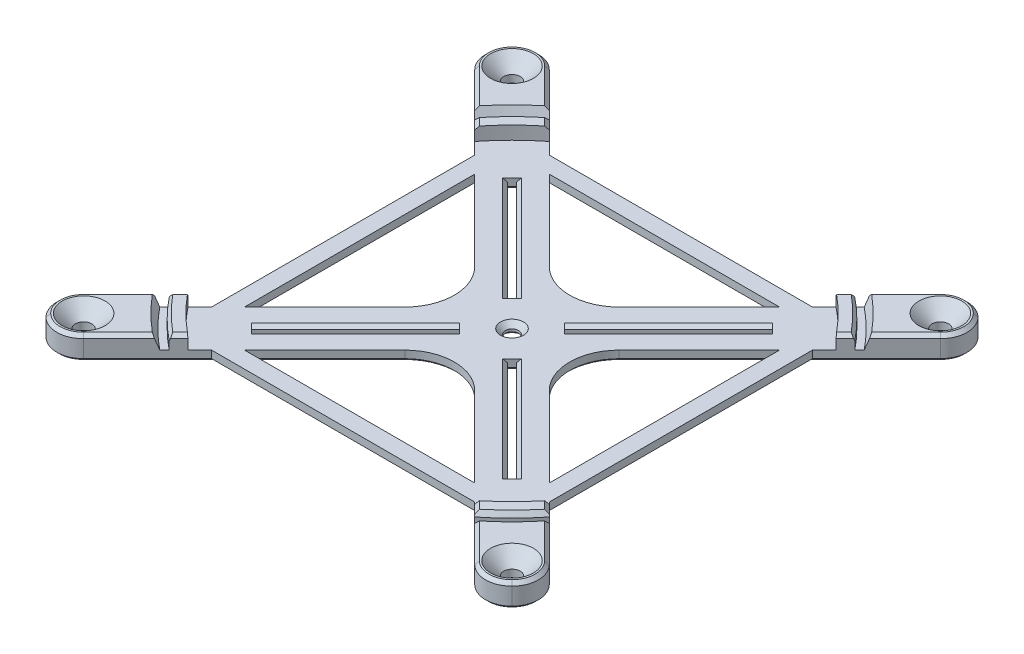
from build123d import *

# Parameters (mm, degrees)
EXTRUDE_1_DEPTH     = 14
EXTRUDE_2_DEPTH     = 14
FILLET_1_R          = 16
SKETCH_3_R          = 5
SKETCH_3_R_2        = 4
CUT_EXTRUDE_1_DEPTH = 208.101215987
FILLET_2_R          = 30
SKETCH_5_R          = 140
CUT_EXTRUDE_2_DEPTH = 8
CHAMFER_3_SIZE      = 8
CHAMFER_4_SIZE      = 2
CHAMFER_5_SIZE      = 3
CUT_EXTRUDE_4_DEPTH = 207.782285661
CHAMFER_6_SIZE      = 2
SKETCH_9_W          = 172.613296279
SKETCH_9_H          = 10
SKETCH_9_W_2        = 10
SKETCH_9_H_2        = 172.613296279
EXTRUDE_3_DEPTH     = 6
CHAMFER_7_SIZE      = 1.5
CHAMFER_8_SIZE      = 1.732050808
CHAMFER_8_SIZE_2    = 3


# Some blends are built 0.0001 mm under size
with BuildPart() as part:
    # Эскиз1 → Бобышка-Вытянуть1 (new body)
    with BuildSketch(Plane(origin=(0, 0, 0), x_dir=(1, 0, 0), z_dir=(0, 1, 0))):
        Polygon((130.107647738, -152.735064736), (-152.735064736, 130.107647738), (-130.107647738, 152.735064736), (152.735064736, -130.107647738), align=None)
    extrude(amount=EXTRUDE_1_DEPTH)

    # Эскиз2 → Бобышка-Вытянуть2 (add)
    with BuildSketch(Plane(origin=(0, 0, 0), x_dir=(1, 0, 0), z_dir=(0, 1, 0))):
        Polygon((-152.735064736, -130.107647738), (130.107647738, 152.735064736), (152.735064736, 130.107647738), (-130.107647738, -152.735064736), align=None)
    extrude(amount=EXTRUDE_2_DEPTH)

    # Скругление1
    fillet_1_edges = [part.edges().sort_by_distance(p)[0] for p in [
        (-130.107647738, 7, -152.735064736),
        (-152.735064736, 7, -130.107647738),
        (130.107647738, 7, 152.735064736),
        (152.735064736, 7, 130.107647738),
        (-130.107647738, 7, 152.735064736),
        (-152.735064736, 7, 130.107647738),
        (130.107647738, 7, -152.735064736),
        (152.735064736, 7, -130.107647738),
    ]]
    fillet(fillet_1_edges, radius=FILLET_1_R - 0.0001)  # a hair under: the kernel refuses the full size

    # Эскиз3 → Cut-Extrude 1 (cut, through all)
    with BuildSketch(Plane(origin=(0, 14, 0), x_dir=(1, 0, 0), z_dir=(0, 1, 0))):
        with Locations(Location((-130, -130, 0), (0, 0, 270))):
            Circle(SKETCH_3_R)
        with Locations(Location((-130, 130, 0), (0, 0, 270))):
            Circle(SKETCH_3_R)
        with Locations(Location((130, 130, 0), (0, 0, 270))):
            Circle(SKETCH_3_R)
        with Locations(Location((130, -130, 0), (0, 0, 270))):
            Circle(SKETCH_3_R)
        with Locations(Location((0, 0, 0), (0, 0, 270))):
            Circle(SKETCH_3_R_2)
    extrude(amount=-CUT_EXTRUDE_1_DEPTH, mode=Mode.SUBTRACT)

    # Скругление2
    fillet_2_edges = [part.edges().sort_by_distance(p)[0] for p in [
        (22.627416998, 7, 0),
        (0, 7, 22.627416998),
        (0, 7, -22.627416998),
        (-22.627416998, 7, 0),
    ]]
    fillet(fillet_2_edges, radius=FILLET_2_R)

    # Эскиз5 → Вырез-Вытянуть2 (cut)
    with BuildSketch(Plane(origin=(0, 14, 0), x_dir=(1, 0, 0), z_dir=(0, 1, 0))):
        Circle(SKETCH_5_R)
    extrude(amount=-CUT_EXTRUDE_2_DEPTH, mode=Mode.SUBTRACT)

    # Фаска3
    chamfer_3_edges = [part.edges().sort_by_distance(p)[0] for p in [
        (130, 14, 125),
        (130, 14, -135),
        (-130, 14, -135),
        (-130, 14, 125),
    ]]
    chamfer(chamfer_3_edges, length=CHAMFER_3_SIZE)

    # Фаска4
    chamfer_4_edges = [part.edges().sort_by_distance(p)[0] for p in [
        (125.540731136, 14, -102.913314138),
        (-125.540731136, 14, 102.913314138),
        (102.913314138, 14, 125.540731136),
        (-102.913314138, 14, -125.540731136),
        (-102.913314138, 14, 125.540731136),
        (-125.540731136, 14, -102.913314138),
        (125.540731136, 14, 102.913314138),
        (102.913314138, 14, -125.540731136),
        (-146.10768916, 14, -130.107647738),
        (-130.107647738, 14, -146.10768916),
        (146.10768916, 14, 130.107647738),
        (130.107647738, 14, 146.10768916),
        (146.10768916, 14, -130.107647738),
        (130.107647738, 14, -146.10768916),
        (-146.10768916, 14, 130.107647738),
        (-130.107647738, 14, 146.10768916),
    ]]
    chamfer(chamfer_4_edges, length=CHAMFER_4_SIZE)

    # Фаска5
    chamfer_5_edges = [part.edges().sort_by_distance(p)[0] for p in [
        (0, 6, -4),
    ]]
    chamfer(chamfer_5_edges, length=CHAMFER_5_SIZE)

    # Эскиз8 → Вырез-Вытянуть4 (cut, through all)
    with BuildSketch(Plane(origin=(0, 6, 0), x_dir=(1, 0, 0), z_dir=(0, 1, 0))):
        Polygon((14.516290338, 17.344717463), (77.659021124, 80.487448249), (80.487448249, 77.659021124), (17.344717463, 14.516290338), align=None)
        Polygon((17.344717463, -14.516290338), (80.487448249, -77.659021124), (77.659021124, -80.487448249), (14.516290338, -17.344717463), align=None)
        Polygon((-14.516290338, -17.344717463), (-77.659021124, -80.487448249), (-80.487448249, -77.659021124), (-17.344717463, -14.516290338), align=None)
        Polygon((-17.344717463, 14.516290338), (-80.487448249, 77.659021124), (-77.659021124, 80.487448249), (-14.516290338, 17.344717463), align=None)
    extrude(amount=-CUT_EXTRUDE_4_DEPTH, mode=Mode.SUBTRACT)

    # Фаска6
    chamfer_6_edges = [part.edges().sort_by_distance(p)[0] for p in [
        (-46.087655731, 6, -48.916082856),
        (-48.916082856, 6, -46.087655731),
        (-48.916082856, 6, 46.087655731),
        (-46.087655731, 6, 48.916082856),
        (46.087655731, 6, 48.916082856),
        (48.916082856, 6, 46.087655731),
        (48.916082856, 6, -46.087655731),
        (46.087655731, 6, -48.916082856),
    ]]
    chamfer(chamfer_6_edges, length=CHAMFER_6_SIZE)

    # Эскиз9 → Бобышка-Вытянуть3 (add)
    with BuildSketch(Plane(origin=(0, 6, 0), x_dir=(1, 0, 0), z_dir=(0, 1, 0))):
        with Locations((0.14392075, 97.496971679)):
            Rectangle(SKETCH_9_W, SKETCH_9_H)
        with Locations((97.496971679, -0.14392075)):
            Rectangle(SKETCH_9_W_2, SKETCH_9_H_2)
        with Locations((-0.14392075, -97.496971679)):
            Rectangle(SKETCH_9_W, SKETCH_9_H)
        with Locations((-97.496971679, 0.14392075)):
            Rectangle(SKETCH_9_W_2, SKETCH_9_H_2)
    extrude(amount=-EXTRUDE_3_DEPTH)

    # Фаска7
    chamfer_7_edges = [part.edges().sort_by_distance(p)[0] for p in [
        (68.168796056, 0, -45.541379058),
        (45.541379058, 0, 68.168796056),
        (-68.168796056, 0, 45.541379058),
        (-45.541379058, 0, -68.168796056),
        (35.053823869, 0, 0),
        (0, 0, 35.053823869),
        (-35.053823869, 0, 0),
        (0, 0, -35.053823869),
        (-15.930503901, 0, -15.930503901),
        (-48.916082856, 0, -46.087655731),
        (-79.073234687, 0, -79.073234687),
        (-46.087655731, 0, -48.916082856),
        (-15.930503901, 0, 15.930503901),
        (-46.087655731, 0, 48.916082856),
        (-79.073234687, 0, 79.073234687),
        (-48.916082856, 0, 46.087655731),
        (15.930503901, 0, 15.930503901),
        (48.916082856, 0, 46.087655731),
        (79.073234687, 0, 79.073234687),
        (46.087655731, 0, 48.916082856),
        (15.930503901, 0, -15.930503901),
        (46.087655731, 0, -48.916082856),
        (79.073234687, 0, -79.073234687),
        (48.916082856, 0, -46.087655731),
        (-99.331782316, 0, 121.959199314),
        (99.331782316, 0, -121.959199314),
        (121.959199314, 0, 99.331782316),
        (-121.959199314, 0, -99.331782316),
        (45.541379058, 0, -68.168796056),
        (-99.331782316, 0, -121.959199314),
        (-146.10768916, 0, -130.107647738),
        (0, 0, -102.496971679),
        (0, 0, -92.496971679),
        (-130.107647738, 0, -146.10768916),
        (146.10768916, 0, 130.107647738),
        (130.107647738, 0, 146.10768916),
        (146.10768916, 0, -130.107647738),
        (121.959199314, 0, -99.331782316),
        (130.107647738, 0, -146.10768916),
        (68.168796056, 0, 45.541379058),
        (-146.10768916, 0, 130.107647738),
        (102.496971679, 0, 0),
        (92.496971679, 0, 0),
        (-130.107647738, 0, 146.10768916),
        (-45.541379058, 0, 68.168796056),
        (99.331782316, 0, 121.959199314),
        (0, 0, 102.496971679),
        (0, 0, 92.496971679),
        (-121.959199314, 0, 99.331782316),
        (-68.168796056, 0, -45.541379058),
        (-102.496971679, 0, 0),
        (-92.496971679, 0, 0),
        (130, 0, 125),
        (130, 0, -135),
        (-130, 0, -135),
        (0, 0, -4),
        (-130, 0, 125),
    ]]
    chamfer(chamfer_7_edges, length=CHAMFER_7_SIZE)

    # Эскиз10 → Вырез-Повернуть1 (revolve, cut)
    with BuildSketch(Plane(origin=(-11.313708499, 0, -11.313708499), x_dir=(0.7071067811865477, 0, 0.7071067811865475), z_dir=(-0.7071067811865475, 0, 0.7071067811865477))):
        Polygon((164, 14), (164, 6), (168, 6), (171, 14), align=None)
    revolve(axis=Axis((0, 44.930760425, 0), (0, -1, 0)), mode=Mode.SUBTRACT)

    # Фаска8
    # the kernel refuses this chamfer: 3, 1.732050808 mm, written as the material it takes off along each edge
    with BuildSketch(Plane(origin=(0, 14, 0), x_dir=(-0.8031570836955977, 0, -0.5957673194373645), z_dir=(-0.5957673194373645, 0, 0.8031570836955977))) as chamfer_8_piece_1:
        Polygon((148 - CHAMFER_8_SIZE, 0), (148, CHAMFER_8_SIZE_2), (148, 0), align=None)
    revolve(axis=Axis((0, 14, 0), (0, -1, 0)), revolution_arc=16.865296177, mode=Mode.SUBTRACT)
    with BuildSketch(Plane(origin=(0, 14, 0), x_dir=(-0.5957673194373628, 0, 0.8031570836955989), z_dir=(0.8031570836955989, 0, 0.5957673194373628))) as chamfer_8_piece_2:
        Polygon((148, CHAMFER_8_SIZE_2), (148 - CHAMFER_8_SIZE, 0), (148, 0), align=None)
    revolve(axis=Axis((0, 14, 0), (0, -1, 0)), revolution_arc=16.865296177, mode=Mode.SUBTRACT)
    with BuildSketch(Plane(origin=(0, 14, 0), x_dir=(0.8031570836955976, 0, 0.5957673194373646), z_dir=(0.5957673194373646, 0, -0.8031570836955976))) as chamfer_8_piece_3:
        Polygon((148 - CHAMFER_8_SIZE, 0), (148, CHAMFER_8_SIZE_2), (148, 0), align=None)
    revolve(axis=Axis((0, 14, 0), (0, -1, 0)), revolution_arc=16.865296177, mode=Mode.SUBTRACT)
    with BuildSketch(Plane(origin=(0, 14, 0), x_dir=(0.5957673194373634, 0, -0.8031570836955986), z_dir=(-0.8031570836955986, 0, -0.5957673194373634))) as chamfer_8_piece_4:
        Polygon((148 - CHAMFER_8_SIZE, 0), (148, CHAMFER_8_SIZE_2), (148, 0), align=None)
    revolve(axis=Axis((0, 14, 0), (0, -1, 0)), revolution_arc=16.865296177, mode=Mode.SUBTRACT)


solid = part.part
